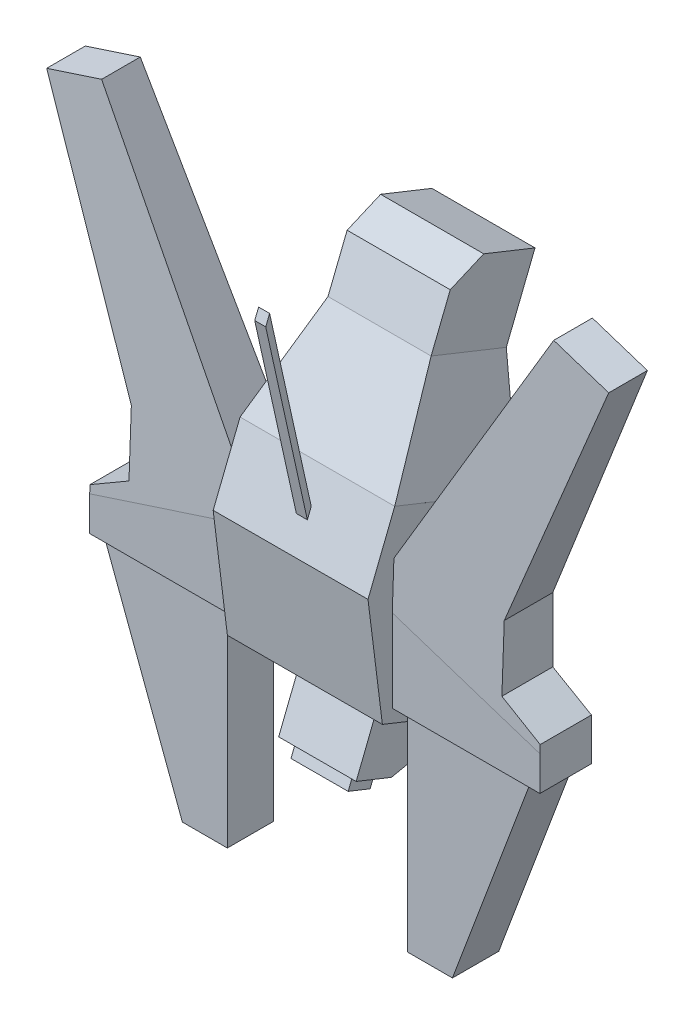
from build123d import *
from OCP.BRepFilletAPI import BRepFilletAPI_MakeChamfer

# Parameters (mm, degrees)
BOSS_EXTRUDE1_DEPTH  = 5.08
CHAMFER5_SIZE        = 1.27
CHAMFER5_SIZE2       = 33.019999999999996
SKETCH6_W            = 12.052934308980802
SKETCH6_H            = 4.563994413231876
BOSS_EXTRUDE2_DEPTH  = 20.32
CHAMFER6_SIZE        = 20.32
CHAMFER6_SIZE_2      = 7.62
BOSS_EXTRUDE5_DEPTH  = 19.05
CUT_EXTRUDE4_DEPTH   = 15.494
CUT_EXTRUDE5_DEPTH   = 15.494
CUT_EXTRUDE6_DEPTH   = 15.494
CUT_EXTRUDE7_DEPTH   = 15.494
CHAMFER7_SIZE        = 25.4
CHAMFER7_SIZE_2      = 13.97
CUT_EXTRUDE9_DEPTH   = 15.494
BOSS_EXTRUDE7_DEPTH  = 6.35
SKETCH24_W           = 3.7386650704626128
SKETCH24_H           = 3.778783012789209
SKETCH24_W_2         = 3.9045544155871448
SKETCH24_H_2         = 3.7787830127892117
CUT_EXTRUDE11_DEPTH  = 19.05
CHAMFER9_SIZE        = 2.54
CHAMFER9_SIZE2       = 3.8099999999999996
SKETCH26_W           = 23.370745721099873
SKETCH26_H           = 31.500943766528344
CUT_EXTRUDE14_DEPTH  = 1.2699999999999978
SKETCH27_W           = 5.63305406156012
SKETCH27_H           = 2.3288196199824216
BOSS_EXTRUDE9_DEPTH  = 1.2699999999999978
SKETCH30_W           = 1.0845533410304151
SKETCH30_H           = 1.0329414918412994
SKETCH34_W           = 15.244980385835458
SKETCH34_H           = 13.062490152383763
BOSS_EXTRUDE14_DEPTH = 10.16
CHAMFER11_SIZE       = 2.54
CHAMFER11_SIZE_2     = 10.16
SKETCH38_W           = 10.164980385835456
SKETCH38_H           = 7.9824901523837575
BOSS_EXTRUDE15_DEPTH = 7.62
CHAMFER12_SIZE       = 2.54


# Some blends are built 0.0001 mm under size
with BuildPart() as part:
    # Sketch4 → Boss-Extrude1 (new body)
    with BuildSketch(Plane.XY):
        Polygon((0, 0), (0, 12.7), (-14.664448494293428, 38.099999999999994), (-20.084228903343057, 36.328898401943476), (-10.761091691630092, 12.71368779454834), (-10.761091691630092, 6.3636877945483405), (-14.57109169163009, 4.164020520404326), (-14.57109169163009, 0), align=None)
    extrude(amount=BOSS_EXTRUDE1_DEPTH)

    # Chamfer5
    chamfer5_edges = [part.edges().sort_by_distance(p)[0] for p in [
        (-17.374338698818242, 37.214449200971735, 5.08),
    ]]
    chamfer5_side = [part.faces().sort_by_distance(p)[0] for p in [
        (-17.374338698818242, 37.214449200971735, 2.54),
    ]]
    chamfer(chamfer5_edges, length=CHAMFER5_SIZE, length2=CHAMFER5_SIZE2, reference=chamfer5_side[0])

    # Sketch6 → Boss-Extrude2 (add)
    with BuildSketch(Plane.XZ):
        with Locations((-7.2855458458150455, 2.54)):
            Rectangle(SKETCH6_W, SKETCH6_H)
    extrude(amount=BOSS_EXTRUDE2_DEPTH)

    # Chamfer6
    # the kernel refuses this chamfer: 20.32, 7.62 mm, written as the material it takes off along each edge
    with BuildSketch(Plane(origin=(-13.312013000305447, -20.32, 57.52944740394708), x_dir=(-0.013536660009854505, 0.9999083752203387, 0), z_dir=(0, 0, -1))) as chamfer6_piece_1_section:
        Polygon((CHAMFER6_SIZE * 0.99990837522, CHAMFER6_SIZE * 0.0135366600099), (-CHAMFER6_SIZE_2 * 0.0135366600099, CHAMFER6_SIZE_2 * 0.99990837522), (0, 0), align=None)
    chamfer6_piece_1 = extrude(amount=109.97889480789416, mode=Mode.PRIVATE)
    chamfer6_piece_1 = split(chamfer6_piece_1, bisect_by=Plane(origin=(-10.948471131308636, 0, 2.5400000000000014), z_dir=(0, -1, 0)), keep=Keep.TOP, mode=Mode.PRIVATE)
    add(chamfer6_piece_1, mode=Mode.SUBTRACT)


with BuildPart() as body_2:
    # Mirror8: mirrored copy
    add(part.part.mirror(Plane(origin=(7.619999999999999, 0, 0), x_dir=(0, 0, 1), z_dir=(1, 0, 0))))


with BuildPart() as part_1:
    add(part.part)

    add(body_2.part)  # Boss-Extrude5 merges body 2
    # Sketch7 → Boss-Extrude5 (add, symmetric)
    with BuildSketch(Plane(origin=(0, 0, 0), x_dir=(0, -1, 0), z_dir=(0, 0, 1))):
        Polygon((5.0986751933069705, 0), (5.0986751933069705, 15.280255393277036), (-20.245687537827482, 15.239999999999998), (-20.245687537827482, 0), align=None)
    extrude(amount=BOSS_EXTRUDE5_DEPTH, both=True)

    # Sketch13 → Cut-Extrude4 (cut)
    with BuildSketch(Plane(origin=(15.272118449240836, 0.02425727333804481, 0), x_dir=(0, 0, -1), z_dir=(0.9999987385949102, 0.0015883351625656467, 0))):
        Polygon((-19.05, 4.286246257710902), (4.496404811954787, -5.122938928746256), (-19.05, -5.122938928746256), align=None)
    extrude(amount=-CUT_EXTRUDE4_DEPTH, mode=Mode.SUBTRACT)

    # Sketch18 → Cut-Extrude5 (cut)
    with BuildSketch(Plane(origin=(0, -5.0986751933069705, 19.05), x_dir=(0, 0, -1), z_dir=(1, 0, 0))):
        Polygon((38.1, 0), (38.1, 25.344362731134453), (33.61333406805571, 25.344362731134453), (23.485668928436706, 0), align=None)
    extrude(amount=CUT_EXTRUDE5_DEPTH, mode=Mode.SUBTRACT)

    # Sketch19 → Cut-Extrude6 (cut)
    with BuildSketch(Plane.ZY):
        Polygon((12.672573032991338, 20.245687537827482), (19.05, 4.286251664410568), (19.05, 20.245687537827482), align=None)
    extrude(amount=-CUT_EXTRUDE6_DEPTH, mode=Mode.SUBTRACT)

    # Sketch20 → Cut-Extrude7 (cut)
    with BuildSketch(Plane.ZY):
        Polygon((-10.813095895445443, 10.860760680109815), (12.672573032991338, 20.245687537827482), (-14.563334068055712, 20.245687537827482), align=None)
    extrude(amount=-CUT_EXTRUDE7_DEPTH, mode=Mode.SUBTRACT)

    # Chamfer7
    # the kernel refuses this chamfer: 25.4, 13.97 mm, written as the material it takes off along each edge
    with BuildSketch(Plane(origin=(-65.73691449265259, 4.196216304667381, 19.08597833505926), x_dir=(-0.0014746788980924302, 0.9353516299299037, -0.3537162050424322), z_dir=(0.9999989122833349, 0.0013696301766686866, -0.0005473073417378643))) as chamfer7_piece_1:
        Polygon((CHAMFER7_SIZE * 0.999826618339, -CHAMFER7_SIZE * 0.018620774985), (-CHAMFER7_SIZE_2 * 0.018620774985, -CHAMFER7_SIZE_2 * 0.999826618339), (0, 0), align=None)
    extrude(amount=146.73930435250884, mode=Mode.SUBTRACT)

    # Sketch21 → Cut-Extrude9 (cut)
    with BuildSketch(Plane.ZY):
        Polygon((8.477655483236292, 18.569388919356417), (4.825777553004942, 17.110090171129713), (7.479050890335823, 10.47030489395858), align=None)
    extrude(amount=-CUT_EXTRUDE9_DEPTH, mode=Mode.SUBTRACT)

    # Sketch22 → Boss-Extrude7 (add)
    with BuildSketch(Plane(origin=(0.00455562028050382, -2.868169540906279, 1.1461270887773878), x_dir=(0.9999989122833348, 0.0013696301766686846, -0.0005473073417378687), z_dir=(0.001474934624707707, -0.9286029793832664, 0.3710718680368721))):
        Polygon((7.635563761108569, -6.010956849215719), (11.537018076990257, -6.010956849215718), (11.537018076990257, 1.5466091763627066), (3.899998790351411, 1.5466091763627066), (3.899998790351413, -6.010956849215722), align=None)
    extrude(amount=BOSS_EXTRUDE7_DEPTH)

    # Sketch24 → Cut-Extrude11 (cut)
    with BuildSketch(Plane(origin=(0.00455562028050382, -2.868169540906279, 1.1461270887773878), x_dir=(0.9999989122833348, 0.0013696301766686846, -0.0005473073417378687), z_dir=(0.001474934624707707, -0.9286029793832664, 0.3710718680368722))):
        with Locations((13.406350612221562, -4.121565342821113)):
            Rectangle(SKETCH24_W, SKETCH24_H)
        with Locations((1.9477215825578391, -4.121565342821115)):
            Rectangle(SKETCH24_W_2, SKETCH24_H_2)
    extrude(amount=-CUT_EXTRUDE11_DEPTH, mode=Mode.SUBTRACT)

    # Chamfer9
    chamfer9_edges = [part_1.edges().sort_by_distance(p)[0] for p in [
        (7.73242149326798, -10.984726370799283, -2.083589456062718),
    ]]
    chamfer9_side = [part_1.faces().sort_by_distance(p)[0] for p in [
        (7.714767768751576, -0.06198305402502739, -6.44834259236495),
    ]]
    chamfer(chamfer9_edges, length=CHAMFER9_SIZE, length2=CHAMFER9_SIZE2, reference=chamfer9_side[0])

    # Sketch26 → Cut-Extrude14 (cut)
    with BuildSketch(Plane(origin=(0, -2.23049941287892, -5.581798510541238), x_dir=(-1, 0, 0), z_dir=(0, -0.37107227165836976, -0.9286039894412996))):
        with Locations((-7.42917145975186, 4.586757393504559)):
            Rectangle(SKETCH26_W, SKETCH26_H)
    extrude(amount=-CUT_EXTRUDE14_DEPTH, mode=Mode.SUBTRACT)

    # Sketch27 → Boss-Extrude9 (add)
    with BuildSketch(Plane(origin=(0.01392145514739876, -8.76479845999002, 3.5024334508115262), x_dir=(0.9999989122833348, 0.0013696301766687824, -0.0005473073417379074), z_dir=(0.0014749346247078124, -0.9286029793832665, 0.371071868036872))):
        with Locations((7.7185084336708325, -0.353981031334653)):
            Rectangle(SKETCH27_W, SKETCH27_H)
    extrude(amount=BOSS_EXTRUDE9_DEPTH)

    # Sweep3: sweep along a path in Sketch31
    with BuildLine(Plane(origin=(7.619999999999999, -5.0986751933069705, 19.05), x_dir=(0, 0, -1), z_dir=(1, 0, 0))) as sweep3_path:
        Line((12.859063600877302, 18.79247143047996), (8.75450408234446, 37.3194963828567))
    # Sketch30 → Sweep3 (sweep)
    with BuildSketch(Plane(origin=(0, 4.018830078140977, 10.057074937909151), x_dir=(1, 0, 0), z_dir=(0, 0.3710722716583693, 0.9286039894412997))):
        with Locations((7.6507653900392825, 10.410250498608775)):
            Rectangle(SKETCH30_W, SKETCH30_H)
    sweep(path=sweep3_path.line)

    # Sketch34 → Boss-Extrude14 (add)
    with BuildSketch(Plane(origin=(0, 13.091260092988732, -5.231297384904211), x_dir=(1, 0, 0), z_dir=(0, 0.9286039894412996, -0.3710722716583697))):
        with Locations((7.622490192917729, -4.299071239765427)):
            Rectangle(SKETCH34_W, SKETCH34_H)
    extrude(amount=BOSS_EXTRUDE14_DEPTH)

    # Chamfer11
    chamfer11_edges_1 = [part_1.edges().sort_by_distance(p)[0] for p in [
        (15.244980385835458, 24.121142756673255, -5.009256960814719),
    ]]
    chamfer11_side_1 = [part_1.faces().sort_by_distance(p)[0] for p in [
        (15.194180385835457, 24.121142756673255, -5.009256960814719),
    ]]
    chamfer11_edges_2 = [part_1.edges().sort_by_distance(p)[0] for p in [
        (7.622490192917729, 21.697578809493194, -11.074197194585345),
    ]]
    chamfer11_side_2 = [part_1.faces().sort_by_distance(p)[0] for p in [
        (7.622490192917729, 21.650405726829575, -11.0553467231851),
    ]]
    chamfer11_edges_3 = [part_1.edges().sort_by_distance(p)[0] for p in [
        (0, 24.121142756673255, -5.009256960814719),
    ]]
    chamfer11_side_3 = [part_1.faces().sort_by_distance(p)[0] for p in [
        (0, 24.073969674009636, -4.9904064894144735),
    ]]
    chamfer11_edges_4 = [part_1.edges().sort_by_distance(p)[0] for p in [
        (7.622490192917729, 26.54470670385332, 1.055683272955907),
    ]]
    chamfer11_side_4 = [part_1.faces().sort_by_distance(p)[0] for p in [
        (7.622490192917729, 26.4975336211897, 1.074533744356152),
    ]]
    chamfer11 = BRepFilletAPI_MakeChamfer(part_1.part.solid().wrapped)
    for e in chamfer11_edges_1:
        chamfer11.Add(CHAMFER11_SIZE - 0.0001, CHAMFER11_SIZE_2 - 0.0001, e.wrapped, chamfer11_side_1[0].wrapped)
    for e in chamfer11_edges_2:
        chamfer11.Add(CHAMFER11_SIZE_2 - 0.0001, CHAMFER11_SIZE - 0.0001, e.wrapped, chamfer11_side_2[0].wrapped)
    for e in chamfer11_edges_3:
        chamfer11.Add(CHAMFER11_SIZE_2 - 0.0001, CHAMFER11_SIZE - 0.0001, e.wrapped, chamfer11_side_3[0].wrapped)
    for e in chamfer11_edges_4:
        chamfer11.Add(CHAMFER11_SIZE_2 - 0.0001, CHAMFER11_SIZE - 0.0001, e.wrapped, chamfer11_side_4[0].wrapped)
    add(Compound.cast(chamfer11.Shape()), mode=Mode.REPLACE)  # a hair under: the kernel refuses the full size

    # Sketch38 → Boss-Extrude15 (add)
    with BuildSketch(Plane(origin=(0, 22.525876625712346, -9.001391664953251), x_dir=(1, 0, 0), z_dir=(0, 0.9286039894412996, -0.37107227165836976))):
        with Locations((7.622490192917729, -4.299071239765427)):
            Rectangle(SKETCH38_W, SKETCH38_H)
    extrude(amount=BOSS_EXTRUDE15_DEPTH)

    # Chamfer12
    chamfer12_edges = [part_1.edges().sort_by_distance(p)[0] for p in [
        (7.622490192917728, 32.67814553338378, -4.130541570261777),
    ]]
    chamfer(chamfer12_edges, length=CHAMFER12_SIZE)


solid = part_1.part
